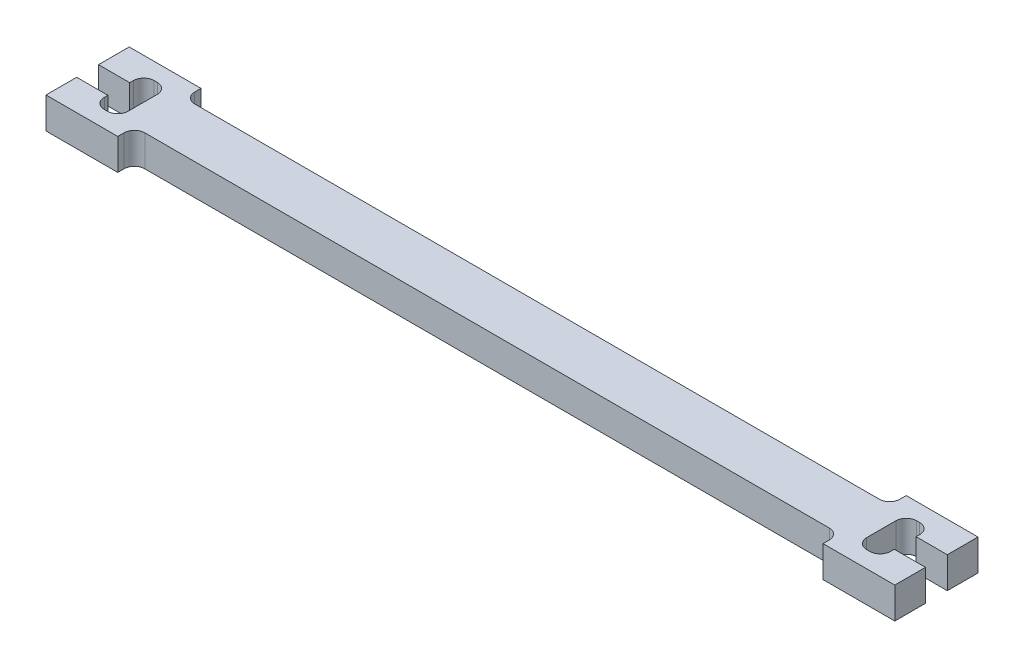
from build123d import *

# Parameters (mm, degrees)
BASE_SHAPE_DEPTH  = 3
MILLING_FILLETS_R = 1


with BuildPart() as part:
    # Sketch1 → Base shape (new body)
    with BuildSketch(Plane(origin=(0, 0, 0), x_dir=(1, 0, 0), z_dir=(0, 1, 0))):
        Polygon((-33.9, 4), (-40.8, 4), (-40.8, 1.05), (-37.8, 1.05), (-37.8, 2.4), (-35.5, 2.4), (-35.5, -2.4), (-37.8, -2.4), (-37.8, -1.05), (-40.8, -1.05), (-40.8, -4), (-33.9, -4), (-33.9, -2.4), (33.9, -2.4), (33.9, -4), (40.8, -4), (40.8, -1.05), (37.8, -1.05), (37.8, -2.4), (35.5, -2.4), (35.5, 2.4), (37.8, 2.4), (37.8, 1.05), (40.8, 1.05), (40.8, 4), (33.9, 4), (33.9, 2.4), (-33.9, 2.4), align=None)
    extrude(amount=BASE_SHAPE_DEPTH)

    # Milling fillets
    milling_fillets_edges = [part.edges().sort_by_distance(p)[0] for p in [
        (37.8, 1.5, 2.4),
        (-35.5, 1.5, 2.4),
        (-37.8, 1.5, 2.4),
        (35.5, 1.5, 2.4),
        (35.5, 1.5, -2.4),
        (-37.8, 1.5, -2.4),
        (-35.5, 1.5, -2.4),
        (37.8, 1.5, -2.4),
        (33.9, 1.5, 2.4),
        (33.9, 1.5, -2.4),
        (-33.9, 1.5, -2.4),
        (-33.9, 1.5, 2.4),
    ]]
    fillet(milling_fillets_edges, radius=MILLING_FILLETS_R)


solid = part.part
